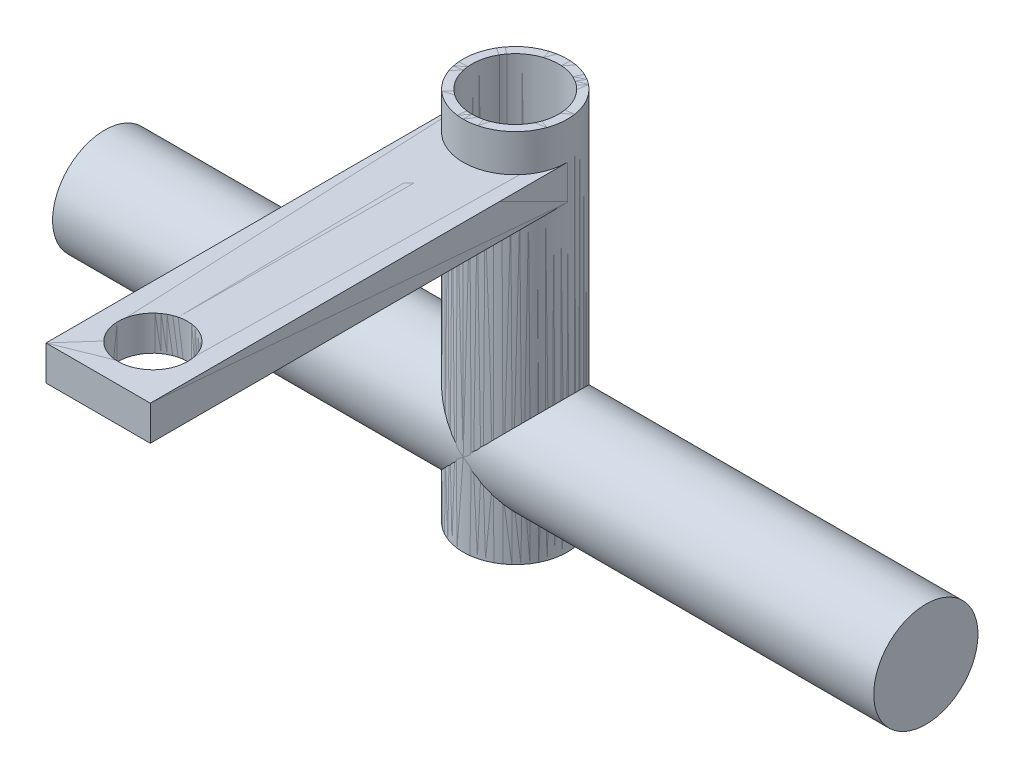
from build123d import *

# Parameters (mm, degrees)
SLEEVE_DEPTH       = 63.5
SLEEVE_DEPTH_BACK  = 5
SKETCH1_R          = 9.525
SKETCH2_W          = 19.05
SKETCH2_H          = 6.35
BRACKET_DEPTH      = 76.2
SKETCH4_R          = 6.35
BRACKET_HOLE_DEPTH = 100.646453148
SKETCH5_R          = 9.525
SHAFT_DEPTH        = 75
SKETCH6_R          = 7.9375
SLEEVE_HOLE_DEPTH  = 125.353086009


with BuildPart() as part:
    # Sketch1 → Sleeve (new, two sides: drawn at the far end of the back side and taken through both)
    with BuildSketch(Plane(origin=(0, 0, 0), x_dir=(1, 0, 0), z_dir=(0, 1, 0)).offset(-SLEEVE_DEPTH_BACK)):
        Circle(SKETCH1_R)
    extrude(amount=SLEEVE_DEPTH + SLEEVE_DEPTH_BACK)

    # Sketch2 → Bracket (add)
    with BuildSketch(Plane.XY):
        with Locations((0, 53.5)):
            Rectangle(SKETCH2_W, SKETCH2_H)
    extrude(amount=BRACKET_DEPTH)

    # Sketch4 → Bracket Hole (cut, through all)
    with BuildSketch(Plane(origin=(0, 0, 0), x_dir=(1, 0, 0), z_dir=(0, 1, 0))):
        with Locations((0, -66.2)):
            Circle(SKETCH4_R)
    extrude(amount=BRACKET_HOLE_DEPTH, mode=Mode.SUBTRACT)

    # Sketch5 → Shaft (add)
    with BuildSketch(Plane(origin=(0, 0, 0), x_dir=(0, 0, -1), z_dir=(1, 0, 0))):
        with Locations((0, 10)):
            Circle(SKETCH5_R)
    extrude(amount=SHAFT_DEPTH)

    # Sketch6 → Sleeve Hole (cut, through all)
    with BuildSketch(Plane(origin=(0, 0, 0), x_dir=(1, 0, 0), z_dir=(0, 1, 0))):
        Circle(SKETCH6_R)
    extrude(amount=SLEEVE_HOLE_DEPTH, mode=Mode.SUBTRACT)


with BuildPart() as body_2:
    # Mirror1: mirrored copy
    add(part.part.mirror(Plane(origin=(0, 0, 0), x_dir=(0, 0, 1), z_dir=(1, 0, 0))))


solid = Compound([part.part, body_2.part])
